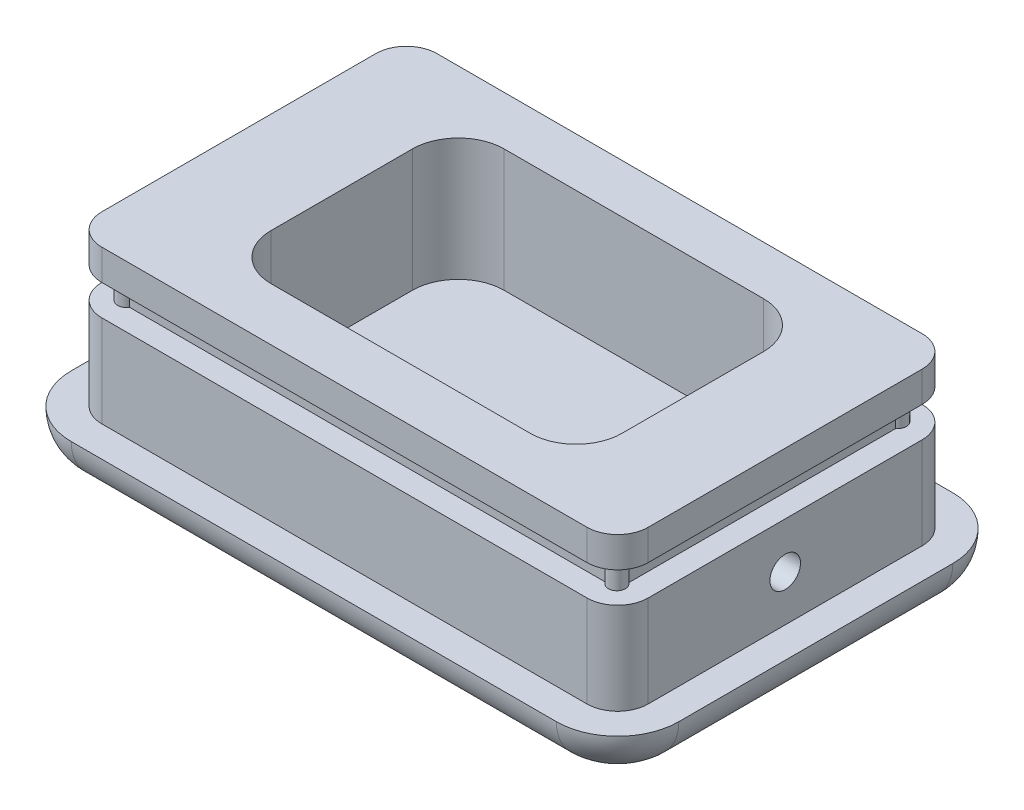
from build123d import *

# Parameters (mm, degrees)
SALIENTE_EXTRUIR1_DEPTH  = 3
SALIENTE_EXTRUIR3_DEPTH  = 6
SALIENTE_EXTRUIR4_DEPTH  = 2
SALIENTE_EXTRUIR5_DEPTH  = 2
REDONDEO1_R              = 3
CROQUIS5_R               = 1
CORTAR_EXTRUIR1_DEPTH    = 5
CORTAR_EXTRUIR2_START    = -5
CROQUIS6_R               = 1
CORTAR_EXTRUIR2_DEPTH    = 5
SALIENTE_EXTRUIR6_START  = -5
SALIENTE_EXTRUIR6_DEPTH  = 5
CROQUIS9_W               = 22.939215458
CROQUIS9_H               = 15.240437668
CORTAR_EXTRUIR3_DEPTH    = 8
REDONDEO2_R              = 3
SALIENTE_EXTRUIR13_DEPTH = 2
SALIENTE_EXTRUIR15_DEPTH = 2


with BuildPart() as part:
    # Croquis1 → Saliente-Extruir1 (new body)
    with BuildSketch(Plane(origin=(0, 0, 0), x_dir=(1, 0, 0), z_dir=(0, 1, 0))):
        with BuildLine():
            Line((-15.85, -12.95), (15.85, -12.95))
            ThreePointArc((15.85, -12.95), (18.678427125, -11.778427125), (19.85, -8.95))
            Line((19.85, -8.95), (19.85, 8.95))
            ThreePointArc((19.85, 8.95), (18.678427125, 11.778427125), (15.85, 12.95))
            Line((15.85, 12.95), (-15.85, 12.95))
            ThreePointArc((-15.85, 12.95), (-18.678427125, 11.778427125), (-19.85, 8.95))
            Line((-19.85, 8.95), (-19.85, -8.95))
            ThreePointArc((-19.85, -8.95), (-18.678427125, -11.778427125), (-15.85, -12.95))
        make_face()
    extrude(amount=SALIENTE_EXTRUIR1_DEPTH)

    # Croquis2 → Saliente-Extruir3 (add)
    with BuildSketch(Plane(origin=(0, 3, 0), x_dir=(1, 0, 0), z_dir=(0, 1, 0))):
        with BuildLine():
            Line((-15.85, -10.95), (15.85, -10.95))
            ThreePointArc((15.85, -10.95), (17.264213562, -10.364213562), (17.85, -8.95))
            Line((17.85, -8.95), (17.85, 8.95))
            ThreePointArc((17.85, 8.95), (17.264213562, 10.364213562), (15.85, 10.95))
            Line((15.85, 10.95), (-15.85, 10.95))
            ThreePointArc((-15.85, 10.95), (-17.264213562, 10.364213562), (-17.85, 8.95))
            Line((-17.85, 8.95), (-17.85, -8.95))
            ThreePointArc((-17.85, -8.95), (-17.264213562, -10.364213562), (-15.85, -10.95))
        make_face()
    extrude(amount=SALIENTE_EXTRUIR3_DEPTH)

    # Croquis3 → Saliente-Extruir4 (add)
    with BuildSketch(Plane(origin=(0, 9, 0), x_dir=(1, 0, 0), z_dir=(0, 1, 0))):
        with BuildLine():
            Line((-15.85, -9.45), (15.85, -9.45))
            ThreePointArc((15.85, -9.45), (16.203553391, -9.303553391), (16.35, -8.95))
            Line((16.35, -8.95), (16.35, 8.95))
            ThreePointArc((16.35, 8.95), (16.203553391, 9.303553391), (15.85, 9.45))
            Line((15.85, 9.45), (-15.85, 9.45))
            ThreePointArc((-15.85, 9.45), (-16.203553391, 9.303553391), (-16.35, 8.95))
            Line((-16.35, 8.95), (-16.35, -8.95))
            ThreePointArc((-16.35, -8.95), (-16.203553391, -9.303553391), (-15.85, -9.45))
        make_face()
    extrude(amount=SALIENTE_EXTRUIR4_DEPTH)

    # Croquis4 → Saliente-Extruir5 (add)
    with BuildSketch(Plane(origin=(0, 11, 0), x_dir=(1, 0, 0), z_dir=(0, 1, 0))):
        with BuildLine():
            Line((-15.85, -10.95), (15.85, -10.95))
            ThreePointArc((15.85, -10.95), (17.264213562, -10.364213562), (17.85, -8.95))
            Line((17.85, -8.95), (17.85, 8.95))
            ThreePointArc((17.85, 8.95), (17.264213562, 10.364213562), (15.85, 10.95))
            Line((15.85, 10.95), (-15.85, 10.95))
            ThreePointArc((-15.85, 10.95), (-17.264213562, 10.364213562), (-17.85, 8.95))
            Line((-17.85, 8.95), (-17.85, -8.95))
            ThreePointArc((-17.85, -8.95), (-17.264213562, -10.364213562), (-15.85, -10.95))
        make_face()
    extrude(amount=SALIENTE_EXTRUIR5_DEPTH)

    # Redondeo1
    redondeo1_edges = [part.edges().sort_by_distance(p)[0] for p in [
        (0, 0, -12.95),
        (-18.678427125, 0, -11.778427125),
        (-19.85, 0, 0),
        (-18.678427125, 0, 11.778427125),
        (0, 0, 12.95),
        (18.678427125, 0, 11.778427125),
        (19.85, 0, 0),
        (18.678427125, 0, -11.778427125),
    ]]
    fillet(redondeo1_edges, radius=REDONDEO1_R - 0.0001)  # a hair under: the kernel refuses the full size

    # Croquis5 → Cortar-Extruir1 (cut)
    with BuildSketch(Plane.ZY.offset(17.85)):
        with Locations((0, 6)):
            Circle(CROQUIS5_R)
    extrude(amount=-CORTAR_EXTRUIR1_DEPTH, mode=Mode.SUBTRACT)

    # Croquis6 → Cortar-Extruir2 (cut)
    with BuildSketch(Plane(origin=(17.85, 0, 0), x_dir=(0, 0, -1), z_dir=(1, 0, 0)).offset(CORTAR_EXTRUIR2_START)):
        with Locations(Location((0, 6, 0), (0, 0, 180))):
            Circle(CROQUIS6_R)
    extrude(amount=CORTAR_EXTRUIR2_DEPTH, mode=Mode.SUBTRACT)

    # Croquis8 → Saliente-Extruir6 (add)
    with BuildSketch(Plane(origin=(0, 13, 0), x_dir=(1, 0, 0), z_dir=(0, 1, 0)).offset(SALIENTE_EXTRUIR6_START)):
        with BuildLine():
            ThreePointArc((16.35, 8.95), (16.287739315, 9.387739315), (15.85, 9.45))
            ThreePointArc((15.85, 9.45), (16.203553391, 9.303553391), (16.35, 8.95))
        make_face()
        with BuildLine():
            ThreePointArc((15.85, -9.45), (16.203553391, -9.303553391), (16.35, -8.95))
            ThreePointArc((16.35, -8.95), (16.287739315, -9.387739315), (15.85, -9.45))
        make_face()
        with BuildLine():
            ThreePointArc((-16.35, -8.95), (-16.203553391, -9.303553391), (-15.85, -9.45))
            ThreePointArc((-15.85, -9.45), (-16.287739315, -9.387739315), (-16.35, -8.95))
        make_face()
        with BuildLine():
            ThreePointArc((-16.35, 8.95), (-16.287739315, 9.387739315), (-15.85, 9.45))
            ThreePointArc((-15.85, 9.45), (-16.203553391, 9.303553391), (-16.35, 8.95))
        make_face()
    extrude(amount=SALIENTE_EXTRUIR6_DEPTH)

    # Croquis9 → Cortar-Extruir3 (cut)
    with BuildSketch(Plane(origin=(0, 13, 0), x_dir=(1, 0, 0), z_dir=(0, 1, 0))):
        with Locations((0.209490552, 0.130931595)):
            Rectangle(CROQUIS9_W, CROQUIS9_H)
    extrude(amount=-CORTAR_EXTRUIR3_DEPTH, mode=Mode.SUBTRACT)

    # Redondeo2
    redondeo2_edges = [part.edges().sort_by_distance(p)[0] for p in [
        (11.679098281, 9, 7.489287239),
        (-11.260117177, 9, 7.489287239),
        (-11.260117177, 9, -7.751150429),
        (11.679098281, 9, -7.751150429),
    ]]
    fillet(redondeo2_edges, radius=REDONDEO2_R)

    # Croquis11 → Saliente-Extruir13 (add)
    with BuildSketch(Plane(origin=(0, 9, 0), x_dir=(1, 0, 0), z_dir=(0, 1, 0))):
        with BuildLine():
            Line((-16.35, -8.95), (-16.35, -8.722324592))
            ThreePointArc((-16.35, -8.722324592), (-16.402564717, -9.58947242), (-15.545094105, -9.45))
            Line((-15.545094105, -9.45), (-15.85, -9.45))
            ThreePointArc((-15.85, -9.45), (-16.287739315, -9.387739315), (-16.35, -8.95))
        make_face()
        with BuildLine():
            ThreePointArc((16.35, 8.722324592), (16.402564717, 9.58947242), (15.545094105, 9.45))
            Line((15.545094105, 9.45), (15.85, 9.45))
            ThreePointArc((15.85, 9.45), (16.287739315, 9.387739315), (16.35, 8.95))
            Line((16.35, 8.95), (16.35, 8.722324592))
        make_face()
        with BuildLine():
            Line((15.85, -9.45), (15.545094105, -9.45))
            ThreePointArc((15.545094105, -9.45), (16.402564717, -9.58947242), (16.35, -8.722324592))
            Line((16.35, -8.722324592), (16.35, -8.95))
            ThreePointArc((16.35, -8.95), (16.287739315, -9.387739315), (15.85, -9.45))
        make_face()
    extrude(amount=SALIENTE_EXTRUIR13_DEPTH)

    # Croquis13 → Saliente-Extruir15 (add)
    with BuildSketch(Plane(origin=(0, 9, 0), x_dir=(1, 0, 0), z_dir=(0, 1, 0))):
        with BuildLine():
            Line((-16.35, 8.95), (-16.35, 8.457615485))
            ThreePointArc((-16.35, 8.457615485), (-16.500312948, 9.537460741), (-15.413569935, 9.45))
            Line((-15.413569935, 9.45), (-15.85, 9.45))
            ThreePointArc((-15.85, 9.45), (-16.287739315, 9.387739315), (-16.35, 8.95))
        make_face()
    extrude(amount=SALIENTE_EXTRUIR15_DEPTH)


solid = part.part
